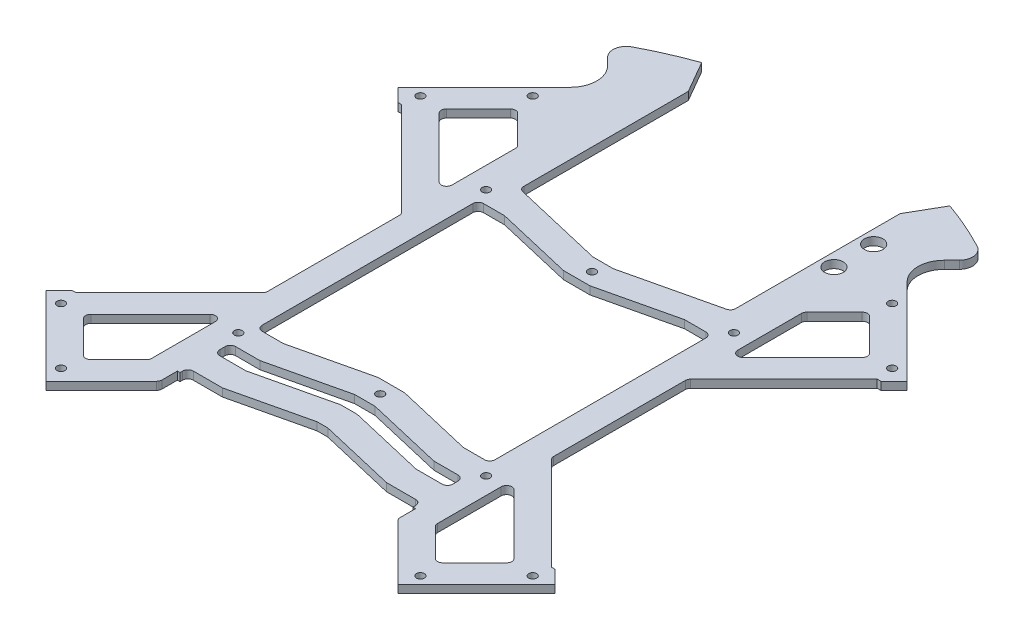
from build123d import *

# Parameters (mm, degrees)
SKETCH1_R                = 140
BOSS_EXTRUDE1_DEPTH      = 3
CUT_EXTRUDE4_REACH       = 200.013
CUT_EXTRUDE8_REACH       = 200.013
SKETCH12_R               = 1.5
FILLET2_R                = 5
FILLET2_OF_MIRROR1_R     = 5
MIRROR2_OUTLINE_R        = 1.5
MIRROR2_DEPTH            = 3
SKETCH17_W               = 69.949291675
SKETCH17_H               = 47
CUT_EXTRUDE11_DEPTH      = 199.01262586
CUT_EXTRUDE13_REACH      = 200.013
CUT_EXTRUDE16_REACH      = 200.013
CUT_EXTRUDE25_DEPTH      = 199.01262586
CUT_EXTRUDE25_DEPTH_BACK = 199.01262586
FILLET7_R                = 2
CUT_EXTRUDE28_REACH      = 200.013
SKETCH35_R               = 1.5
FILLET14_R               = 2
CUT_EXTRUDE29_REACH      = 171.873
SKETCH36_R               = 3.5
CUT_EXTRUDE31_REACH      = 171.873
CUT_EXTRUDE30_REACH      = 171.873
CUT_EXTRUDE32_START      = -3
CUT_EXTRUDE32_DEPTH      = 3
CUT_EXTRUDE33_REACH      = 165.276
FILLET15_R               = 2
FILLET15_OF_MIRROR4_R    = 2
MIRROR5_DEPTH            = 3
FILLET16_R               = 2
CHAMFER1_SIZE            = 1


# Read off the part's stored shape, not the designer's step: Mirror2, Mirror5
with BuildPart() as part:
    # Sketch1 → Boss-Extrude1 (new body)
    with BuildSketch(Plane(origin=(0, 0, 0), x_dir=(1, 0, 0), z_dir=(0, 1, 0))):
        with Locations(Location((0, 0, 0), (0, 0, 270))):
            Circle(SKETCH1_R)
    extrude(amount=BOSS_EXTRUDE1_DEPTH)

    # Sketch7 → Cut-Extrude4 (cut, up to next)
    with BuildSketch(Plane(origin=(0, 3, 0), x_dir=(1, 0, 0), z_dir=(0, 1, 0)), mode=Mode.PRIVATE) as cut_extrude4_sk1:
        with BuildLine():
            Line((-99.030304705, -63.604254968), (-63.604254968, -99.030304705))
            ThreePointArc((-63.604254968, -99.030304705), (-60.689967441, -106.066017178), (-63.604254968, -113.101729651))
            Line((-63.604254968, -113.101729651), (-74.246212025, -123.743686708))
            Line((-74.246212025, -123.743686708), (-123.743686708, -74.246212025))
            Line((-123.743686708, -74.246212025), (-113.101729651, -63.604254968))
            ThreePointArc((-113.101729651, -63.604254968), (-106.066017178, -60.689967441), (-99.030304705, -63.604254968))
        make_face()
    cut_extrude4_tool1 = extrude(cut_extrude4_sk1.sketch, amount=-CUT_EXTRUDE4_REACH, mode=Mode.PRIVATE) & part.part
    cut_extrude4 = cut_extrude4_tool1.solids().sort_by_distance((-90.336965, 3, 90.336965))[0]
    add(cut_extrude4, mode=Mode.SUBTRACT)

    # Sketch12 → Cut-Extrude8 (cut, up to next)
    with BuildSketch(Plane.XZ, mode=Mode.PRIVATE) as cut_extrude8_sk1:
        with Locations(Location((-89.09545443, 67.882250994, 0), (0, 0, 270))):
            Circle(SKETCH12_R)
    cut_extrude8_tool1 = extrude(cut_extrude8_sk1.sketch, amount=-CUT_EXTRUDE8_REACH, mode=Mode.PRIVATE) & part.part
    # Sketch12 → Cut-Extrude8 (cut, up to next)
    with BuildSketch(Plane.XZ, mode=Mode.PRIVATE) as cut_extrude8_sk2:
        with Locations(Location((-67.882250994, 89.09545443, 0), (0, 0, 270))):
            Circle(SKETCH12_R)
    cut_extrude8_tool2 = extrude(cut_extrude8_sk2.sketch, amount=-CUT_EXTRUDE8_REACH, mode=Mode.PRIVATE) & part.part
    cut_extrude8_1 = cut_extrude8_tool1.solids().sort_by_distance((-89.095454, 0, 67.882251))[0]
    add(cut_extrude8_1, mode=Mode.SUBTRACT)
    cut_extrude8_2 = cut_extrude8_tool2.solids().sort_by_distance((-67.882251, 0, 89.095454))[0]
    add(cut_extrude8_2, mode=Mode.SUBTRACT)
    cut_extrude8 = cut_extrude8_1 + cut_extrude8_2  # Cut-Extrude8 as one shape, for the pattern or mirror that repeats it

    # Fillet2
    fillet2_edges = [part.edges().sort_by_distance(p)[0] for p in [
        (-120.600184905, 1.5, 71.102710222),
        (-71.102710222, 1.5, 120.600184905),
    ]]
    fillet(fillet2_edges, radius=FILLET2_R)

    # Mirror1: Cut-Extrude4, Cut-Extrude8 across plane
    add(cut_extrude4.mirror(Plane.XY), mode=Mode.SUBTRACT)
    add(cut_extrude8.mirror(Plane.XY), mode=Mode.SUBTRACT)

    # Fillet2 of Mirror1
    fillet2_of_mirror1_edges = [part.edges().sort_by_distance(p)[0] for p in [
        (-120.600184905, 1.5, -71.102710222),
        (-71.102710222, 1.5, -120.600184905),
    ]]
    fillet(fillet2_of_mirror1_edges, radius=FILLET2_OF_MIRROR1_R)

    # Mirror2 outline → Mirror2 (cut)
    with BuildSketch(Plane(origin=(0, 0, 0), x_dir=(1, 0, 0), z_dir=(0, 1, 0))):
        with BuildLine():
            ThreePointArc((65.217850337, 123.881524036), (67.832192841, 120.206382873), (66.424175303, 115.921649986))
            Line((66.424175303, 115.921649986), (63.604254968, 113.101729651))
            ThreePointArc((63.604254968, 113.101729651), (60.689967441, 106.066017178), (63.604254968, 99.030304705))
            Line((63.604254968, 99.030304705), (99.030304705, 63.604254968))
            ThreePointArc((99.030304705, 63.604254968), (106.066017178, 60.689967441), (113.101729651, 63.604254968))
            Line((113.101729651, 63.604254968), (115.921649986, 66.424175303))
            ThreePointArc((115.921649986, 66.424175303), (120.206382873, 67.832192841), (123.881524036, 65.217850337))
            ThreePointArc((123.881524036, 65.217850337), (98.994949366, 98.994949366), (65.217850337, 123.881524036))
        make_face()
        with BuildLine():
            ThreePointArc((65.217850337, -123.881524036), (98.994949366, -98.994949366), (123.881524036, -65.217850337))
            ThreePointArc((123.881524036, -65.217850337), (120.206382873, -67.832192841), (115.921649986, -66.424175303))
            Line((115.921649986, -66.424175303), (113.101729651, -63.604254968))
            ThreePointArc((113.101729651, -63.604254968), (106.066017178, -60.689967441), (99.030304705, -63.604254968))
            Line((99.030304705, -63.604254968), (63.604254968, -99.030304705))
            ThreePointArc((63.604254968, -99.030304705), (60.689967441, -106.066017178), (63.604254968, -113.101729651))
            Line((63.604254968, -113.101729651), (66.424175303, -115.921649986))
            ThreePointArc((66.424175303, -115.921649986), (67.832192841, -120.206382873), (65.217850337, -123.881524036))
        make_face()
        with Locations((89.09545443, -67.882250994)):
            Circle(MIRROR2_OUTLINE_R)
        with Locations((67.882250994, -89.09545443)):
            Circle(MIRROR2_OUTLINE_R)
        with Locations((89.09545443, 67.882250994)):
            Circle(MIRROR2_OUTLINE_R)
        with Locations((67.882250994, 89.09545443)):
            Circle(MIRROR2_OUTLINE_R)
    extrude(amount=MIRROR2_DEPTH, mode=Mode.SUBTRACT)

    # Sketch17 → Cut-Extrude11 (cut, through all)
    with BuildSketch(Plane.XZ):
        with Locations((-0.572770722, 116.5)):
            Rectangle(SKETCH17_W, SKETCH17_H)
    extrude(amount=-CUT_EXTRUDE11_DEPTH, mode=Mode.SUBTRACT)

    # Sketch19 → Cut-Extrude13 (cut, up to next)
    with BuildSketch(Plane(origin=(0, 3, 0), x_dir=(1, 0, 0), z_dir=(0, 1, 0)), mode=Mode.PRIVATE) as cut_extrude13_sk1:
        Polygon((-45, -68), (-43, -68), (-43, -65), (43, -65), (43, -68), (45, -68), (45, -93), (-45, -93), align=None)
    cut_extrude13_tool1 = extrude(cut_extrude13_sk1.sketch, amount=-CUT_EXTRUDE13_REACH, mode=Mode.PRIVATE) & part.part
    add(cut_extrude13_tool1.solids().sort_by_distance((0, 3, 79.059809))[0], mode=Mode.SUBTRACT)

    # Sketch22 → Cut-Extrude16 (cut, up to next)
    with BuildSketch(Plane(origin=(0, 3, 0), x_dir=(1, 0, 0), z_dir=(0, 1, 0)), mode=Mode.PRIVATE) as cut_extrude16_sk1:
        Polygon((-90.509667992, 62.225396744), (-54, 25.715728753), (-54, -25.715728753), (-90.509667992, -62.225396744), (-91.216774773, -61.518289963), (-96.166522241, -66.468037432), (-140, -110.30151519), (-140, 110.30151519), (-96.166522241, 66.468037432), (-91.216774773, 61.518289963), align=None)
    cut_extrude16_tool1 = extrude(cut_extrude16_sk1.sketch, amount=-CUT_EXTRUDE16_REACH, mode=Mode.PRIVATE) & part.part
    cut_extrude16 = cut_extrude16_tool1.solids().sort_by_distance((-105.856734, 3, 0))[0]
    add(cut_extrude16, mode=Mode.SUBTRACT)

    # Sketch30 → Cut-Extrude25 (cut, two sides: drawn at the far end of the back side and taken through both)
    with BuildSketch(Plane(origin=(0, 3, 0), x_dir=(1, 0, 0), z_dir=(0, 1, 0)).offset(-CUT_EXTRUDE25_DEPTH_BACK)):
        with BuildLine():
            Line((63.604254968, -99.030304705), (66.468037432, -96.166522241))
            Line((66.468037432, -96.166522241), (45, -74.69848481))
            Line((45, -74.69848481), (45, -93))
            Line((45, -93), (34.401875115, -93))
            Line((34.401875115, -93), (34.401875115, -135.707446327))
            ThreePointArc((34.401875115, -135.707446327), (50.159600619, -130.705831797), (65.217850337, -123.881524036))
            ThreePointArc((65.217850337, -123.881524036), (67.832192841, -120.206382873), (66.424175303, -115.921649986))
            Line((66.424175303, -115.921649986), (63.604254968, -113.101729651))
            ThreePointArc((63.604254968, -113.101729651), (60.689967441, -106.066017178), (63.604254968, -99.030304705))
        make_face()
        with BuildLine():
            Line((-45, -93), (-45, -74.69848481))
            Line((-45, -74.69848481), (-66.468037432, -96.166522241))
            Line((-66.468037432, -96.166522241), (-63.604254968, -99.030304705))
            ThreePointArc((-63.604254968, -99.030304705), (-60.689967441, -106.066017178), (-63.604254968, -113.101729651))
            Line((-63.604254968, -113.101729651), (-66.424175303, -115.921649986))
            ThreePointArc((-66.424175303, -115.921649986), (-67.832192841, -120.206382872), (-65.217850337, -123.881524036))
            ThreePointArc((-65.217850337, -123.881524036), (-50.711410097, -130.492731161), (-35.54741656, -135.411894514))
            Line((-35.54741656, -135.411894514), (-35.54741656, -93))
            Line((-35.54741656, -93), (-45, -93))
        make_face()
    extrude(amount=CUT_EXTRUDE25_DEPTH + CUT_EXTRUDE25_DEPTH_BACK, mode=Mode.SUBTRACT)

    # Fillet7
    fillet7_edges = [part.edges().sort_by_distance(p)[0] for p in [
        (45, 1.5, 74.69848481),
        (-45, 1.5, 74.69848481),
    ]]
    fillet(fillet7_edges, radius=FILLET7_R)

    # Sketch35 → Cut-Extrude28 (cut, up to next)
    with BuildSketch(Plane(origin=(0, 3, 0), x_dir=(1, 0, 0), z_dir=(0, 1, 0)), mode=Mode.PRIVATE) as cut_extrude28_sk1:
        with Locations(Location((-46, -44, 0), (0, 0, 270))):
            Circle(SKETCH35_R)
    cut_extrude28_tool1 = extrude(cut_extrude28_sk1.sketch, amount=-CUT_EXTRUDE28_REACH, mode=Mode.PRIVATE) & part.part
    # Sketch35 → Cut-Extrude28 (cut, up to next)
    with BuildSketch(Plane(origin=(0, 3, 0), x_dir=(1, 0, 0), z_dir=(0, 1, 0)), mode=Mode.PRIVATE) as cut_extrude28_sk2:
        with Locations(Location((47.6, -44, 0), (0, 0, 270))):
            Circle(SKETCH35_R)
    cut_extrude28_tool2 = extrude(cut_extrude28_sk2.sketch, amount=-CUT_EXTRUDE28_REACH, mode=Mode.PRIVATE) & part.part
    # Sketch35 → Cut-Extrude28 (cut, up to next)
    with BuildSketch(Plane(origin=(0, 3, 0), x_dir=(1, 0, 0), z_dir=(0, 1, 0)), mode=Mode.PRIVATE) as cut_extrude28_sk3:
        with Locations(Location((47.6, 49.6, 0), (0, 0, 270))):
            Circle(SKETCH35_R)
    cut_extrude28_tool3 = extrude(cut_extrude28_sk3.sketch, amount=-CUT_EXTRUDE28_REACH, mode=Mode.PRIVATE) & part.part
    # Sketch35 → Cut-Extrude28 (cut, up to next)
    with BuildSketch(Plane(origin=(0, 3, 0), x_dir=(1, 0, 0), z_dir=(0, 1, 0)), mode=Mode.PRIVATE) as cut_extrude28_sk4:
        with Locations(Location((-46, 49.6, 0), (0, 0, 270))):
            Circle(SKETCH35_R)
    cut_extrude28_tool4 = extrude(cut_extrude28_sk4.sketch, amount=-CUT_EXTRUDE28_REACH, mode=Mode.PRIVATE) & part.part
    # Sketch35 → Cut-Extrude28 (cut, up to next)
    with BuildSketch(Plane(origin=(0, 3, 0), x_dir=(1, 0, 0), z_dir=(0, 1, 0)), mode=Mode.PRIVATE) as cut_extrude28_sk5:
        with Locations(Location((0.8, 42.8, 0), (0, 0, 270))):
            Circle(SKETCH35_R)
    cut_extrude28_tool5 = extrude(cut_extrude28_sk5.sketch, amount=-CUT_EXTRUDE28_REACH, mode=Mode.PRIVATE) & part.part
    # Sketch35 → Cut-Extrude28 (cut, up to next)
    with BuildSketch(Plane(origin=(0, 3, 0), x_dir=(1, 0, 0), z_dir=(0, 1, 0)), mode=Mode.PRIVATE) as cut_extrude28_sk6:
        with Locations(Location((0.8, -37.2, 0), (0, 0, 270))):
            Circle(SKETCH35_R)
    cut_extrude28_tool6 = extrude(cut_extrude28_sk6.sketch, amount=-CUT_EXTRUDE28_REACH, mode=Mode.PRIVATE) & part.part
    add(cut_extrude28_tool1.solids().sort_by_distance((-46, 3, 44))[0], mode=Mode.SUBTRACT)
    add(cut_extrude28_tool2.solids().sort_by_distance((47.6, 3, 44))[0], mode=Mode.SUBTRACT)
    add(cut_extrude28_tool3.solids().sort_by_distance((47.6, 3, -49.6))[0], mode=Mode.SUBTRACT)
    add(cut_extrude28_tool4.solids().sort_by_distance((-46, 3, -49.6))[0], mode=Mode.SUBTRACT)
    add(cut_extrude28_tool5.solids().sort_by_distance((0.8, 3, -42.8))[0], mode=Mode.SUBTRACT)
    add(cut_extrude28_tool6.solids().sort_by_distance((0.8, 3, 37.2))[0], mode=Mode.SUBTRACT)

    # Fillet14
    fillet14_edges = [part.edges().sort_by_distance(p)[0] for p in [
        (-43, 1.5, 65),
        (43, 1.5, 65),
    ]]
    fillet(fillet14_edges, radius=FILLET14_R)

    # Mirror3: Cut-Extrude16 across plane
    add(cut_extrude16.mirror(Plane(origin=(0, 0, 0), x_dir=(0, 0, 1), z_dir=(1, 0, 0))), mode=Mode.SUBTRACT)

    # Sketch36 → Cut-Extrude29 (cut, up to next)
    with BuildSketch(Plane(origin=(0, 3, 0), x_dir=(1, 0, 0), z_dir=(0, 1, 0)), mode=Mode.PRIVATE) as cut_extrude29_sk1:
        with Locations(Location((45, 105, 0), (0, 0, 270))):
            Circle(SKETCH36_R)
    cut_extrude29_tool1 = extrude(cut_extrude29_sk1.sketch, amount=-CUT_EXTRUDE29_REACH, mode=Mode.PRIVATE) & part.part
    # Sketch36 → Cut-Extrude29 (cut, up to next)
    with BuildSketch(Plane(origin=(0, 3, 0), x_dir=(1, 0, 0), z_dir=(0, 1, 0)), mode=Mode.PRIVATE) as cut_extrude29_sk2:
        with Locations(Location((45, 90, 0), (0, 0, 270))):
            Circle(SKETCH36_R)
    cut_extrude29_tool2 = extrude(cut_extrude29_sk2.sketch, amount=-CUT_EXTRUDE29_REACH, mode=Mode.PRIVATE) & part.part
    add(cut_extrude29_tool1.solids().sort_by_distance((45, 3, -105))[0], mode=Mode.SUBTRACT)
    add(cut_extrude29_tool2.solids().sort_by_distance((45, 3, -90))[0], mode=Mode.SUBTRACT)

    # Sketch38 → Cut-Extrude31 (cut, up to next)
    with BuildSketch(Plane(origin=(0, 3, 0), x_dir=(1, 0, 0), z_dir=(0, 1, 0)), mode=Mode.PRIVATE) as cut_extrude31_sk1:
        Polygon((-34, 44.6), (-5, 37.8), (5, 37.8), (34, 44.6), (44, 44.6), (44, -39), (34, -39), (5, -32.2), (-5, -32.2), (-34, -39), (-44, -39), (-44, 44.6), align=None)
    cut_extrude31_tool1 = extrude(cut_extrude31_sk1.sketch, amount=-CUT_EXTRUDE31_REACH, mode=Mode.PRIVATE) & part.part
    add(cut_extrude31_tool1.solids().sort_by_distance((0, 3, -2.8))[0], mode=Mode.SUBTRACT)

    # Sketch37 → Cut-Extrude30 (cut, up to next)
    with BuildSketch(Plane(origin=(0, 3, 0), x_dir=(1, 0, 0), z_dir=(0, 1, 0)), mode=Mode.PRIVATE) as cut_extrude30_sk1:
        Polygon((-40, 120), (-51.547005384, 140), (51.547005384, 140), (40, 120), (40, 56.27812902), (3.843273299, 47.8), (-3.843273299, 47.8), (-40, 56.27812902), align=None)
    cut_extrude30_tool1 = extrude(cut_extrude30_sk1.sketch, amount=-CUT_EXTRUDE30_REACH, mode=Mode.PRIVATE) & part.part
    add(cut_extrude30_tool1.solids().sort_by_distance((0, 3, -96.96449))[0], mode=Mode.SUBTRACT)

    # Sketch39 → Cut-Extrude32 (cut)
    with BuildSketch(Plane(origin=(0, 3, 0), x_dir=(1, 0, 0), z_dir=(0, 1, 0)).offset(CUT_EXTRUDE32_START)):
        Polygon((-44, -49), (-32.843273299, -49), (-3.843273299, -42.2), (3.843273299, -42.2), (32.843273299, -49), (44, -49), (44, -55), (32.149237278, -55), (3.149237278, -48.2), (-3.149237278, -48.2), (-32.149237278, -55), (-44, -55), align=None)
        Polygon((-44, -68), (-44, -65), (-30.992510577, -65), (-1.992510577, -58.2), (1.992510577, -58.2), (30.992510577, -65), (44, -65), (44, -68), align=None)
    extrude(amount=CUT_EXTRUDE32_DEPTH, mode=Mode.SUBTRACT)

    # Sketch40 → Cut-Extrude33 (cut, up to next)
    with BuildSketch(Plane(origin=(0, 3, 0), x_dir=(1, 0, 0), z_dir=(0, 1, 0)), mode=Mode.PRIVATE) as cut_extrude33_sk1:
        Polygon((-81.317279836, -67.175144213), (-66.468037432, -82.024386618), (-54, -69.556349186), (-54, -39.857864376), align=None)
    cut_extrude33_tool1 = extrude(cut_extrude33_sk1.sketch, amount=-CUT_EXTRUDE33_REACH, mode=Mode.PRIVATE) & part.part
    cut_extrude33 = cut_extrude33_tool1.solids().sort_by_distance((-64.408183, 3, 63.267875))[0]
    add(cut_extrude33, mode=Mode.SUBTRACT)

    # Fillet15
    fillet15_edges = [part.edges().sort_by_distance(p)[0] for p in [
        (-81.317279836, 1.5, 67.175144213),
        (-54, 1.5, 39.857864376),
        (-54, 1.5, 69.556349186),
        (-66.468037432, 1.5, 82.024386618),
    ]]
    fillet(fillet15_edges, radius=FILLET15_R)

    # Mirror4: Cut-Extrude33 across plane
    add(cut_extrude33.mirror(Plane(origin=(0, 0, 0), x_dir=(0, 0, 1), z_dir=(1, 0, 0))), mode=Mode.SUBTRACT)

    # Fillet15 of Mirror4
    fillet15_of_mirror4_edges = [part.edges().sort_by_distance(p)[0] for p in [
        (81.317279836, 1.5, 67.175144213),
        (54, 1.5, 39.857864376),
        (54, 1.5, 69.556349186),
        (66.468037432, 1.5, 82.024386618),
    ]]
    fillet(fillet15_of_mirror4_edges, radius=FILLET15_OF_MIRROR4_R)

    # Mirror5 outline → Mirror5 (cut)
    with BuildSketch(Plane(origin=(0, 0, 0), x_dir=(1, 0, 0), z_dir=(0, 1, 0))):
        with BuildLine():
            Line((-54, 44.686291501), (-54, 68.727922061))
            ThreePointArc((-54, 68.727922061), (-54.152240935, 69.493288926), (-54.585786438, 70.142135624))
            Line((-54.585786438, 70.142135624), (-65.053823869, 80.610173055))
            ThreePointArc((-65.053823869, 80.610173055), (-66.468037432, 81.195959493), (-67.882250994, 80.610173055))
            Line((-67.882250994, 80.610173055), (-79.903066274, 68.589357775))
            ThreePointArc((-79.903066274, 68.589357775), (-80.488852712, 67.175144213), (-79.903066274, 65.76093065))
            Line((-79.903066274, 65.76093065), (-57.414213562, 43.272077939))
            ThreePointArc((-57.414213562, 43.272077939), (-55.234633135, 42.838532436), (-54, 44.686291501))
        make_face()
        with BuildLine():
            ThreePointArc((54.585786438, 70.142135624), (54.152240935, 69.493288926), (54, 68.727922061))
            Line((54, 68.727922061), (54, 44.686291501))
            ThreePointArc((54, 44.686291501), (55.234633135, 42.838532436), (57.414213562, 43.272077939))
            Line((57.414213562, 43.272077939), (79.903066274, 65.76093065))
            ThreePointArc((79.903066274, 65.76093065), (80.488852712, 67.175144213), (79.903066274, 68.589357775))
            Line((79.903066274, 68.589357775), (67.882250994, 80.610173055))
            ThreePointArc((67.882250994, 80.610173055), (66.468037432, 81.195959493), (65.053823869, 80.610173055))
            Line((65.053823869, 80.610173055), (54.585786438, 70.142135624))
        make_face()
    extrude(amount=MIRROR5_DEPTH, mode=Mode.SUBTRACT)

    # Fillet16
    fillet16_edges = [part.edges().sort_by_distance(p)[0] for p in [
        (-54, 1.5, -25.715728753),
        (-54, 1.5, 25.715728753),
        (54, 1.5, 25.715728753),
        (54, 1.5, -25.715728753),
        (-44, 1.5, -44.6),
        (44, 1.5, -44.6),
        (44, 1.5, 39),
        (-44, 1.5, 39),
        (-40, 1.5, -56.27812902),
        (40, 1.5, -56.27812902),
        (-44, 1.5, 55),
        (-44, 1.5, 49),
        (44, 1.5, 49),
        (44, 1.5, 55),
        (44, 1.5, 65),
        (-44, 1.5, 65),
    ]]
    fillet(fillet16_edges, radius=FILLET16_R)

    # Chamfer1
    chamfer1_edges = [part.edges().sort_by_distance(p)[0] for p in [
        (90.509667992, 1.5, -62.225396744),
        (90.509667992, 1.5, 62.225396744),
        (-90.509667992, 1.5, 62.225396744),
        (-90.509667992, 1.5, -62.225396744),
    ]]
    chamfer(chamfer1_edges, length=CHAMFER1_SIZE - 0.0001)  # a hair under: the kernel refuses the full size


solid = part.part
